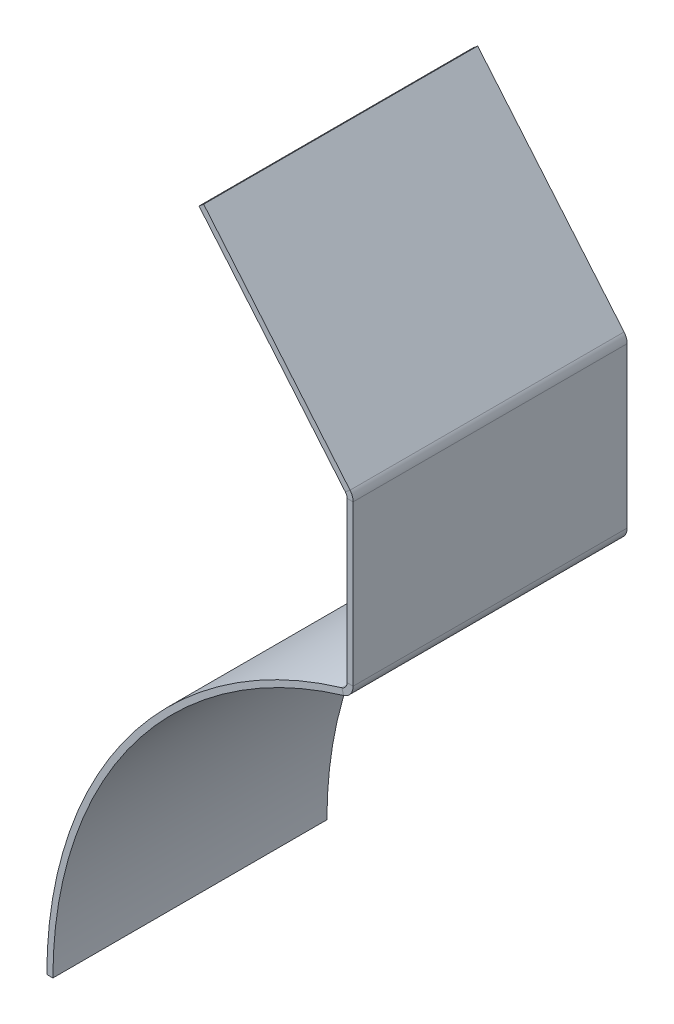
from build123d import *

# Parameters (mm, degrees)
BASE_FLANGE1_DEPTH   = 119.6975
EDGE_FLANGE1_DEPTH   = 119.6975
EDGE_FLANGE2_DEPTH   = 119.6975
EDGE_FLANGE2_2_DEPTH = 119.6975


# Read off the part's stored shape, not the designer's step: Edge-Flange2
# Sheet-metal steps are written as plain solids
with BuildPart() as part:
    # Sketch1 → Base-Flange1 (new body)
    with BuildSketch(Plane.XY):
        with BuildLine():
            ThreePointArc((-50.8, 170.388379885), (-142.557146436, 106.25582337), (-177.8, 0))
            Line((-177.8, 0), (-180.45684, 0))
            ThreePointArc((-180.45684, 0), (-144.68735751, 107.843588959), (-51.559097143, 172.934469105))
            Line((-51.559097143, 172.934469105), (-50.8, 170.388379885))
        make_face()
    extrude(amount=BASE_FLANGE1_DEPTH)

    # Edge-Flange1 section (across the edge) → Edge-Flange1 (add)
    with BuildSketch(Plane(origin=(-49.291175996, 173.610632552, 119.6975), x_dir=(-0.9999999996342678, -2.7045604981568168e-05, 0), z_dir=(0, 0, -1))):
        with BuildLine():
            Line((-2.65684, 2.366572064), (-2.65684, 74.219652496))
            Line((-2.65684, 74.219652496), (0, 74.219652496))
            Line((0, 74.219652496), (0, 2.366572064))
            ThreePointArc((0, 2.366572064), (0.62936233, 0.469112223), (2.267939433, -0.676102109))
            Line((2.267939433, -0.676102109), (1.508911151, -3.222211858))
            ThreePointArc((1.508911151, -3.222211858), (-1.500827273, -1.118682173), (-2.65684, 2.366572064))
        make_face()
    extrude(amount=EDGE_FLANGE1_DEPTH)

    # Edge-Flange2 outline → Edge-Flange2 (cut)
    with BuildSketch(Plane.XY):
        with BuildLine():
            Line((-46.636343312, 247.830356877), (-47.036345835, 247.830346059))
            ThreePointArc((-47.036345835, 247.830346059), (-46.737188142, 246.787726569), (-46.636285905, 245.707740707))
            Line((-46.636285905, 245.707740707), (-46.636343312, 247.830356877))
        make_face()
    extrude(amount=EDGE_FLANGE2_DEPTH, mode=Mode.SUBTRACT)

    # Edge-Flange2 2 outline → Edge-Flange2 2 (add)
    with BuildSketch(Plane.XY):
        with BuildLine():
            ThreePointArc((-47.036345835, 247.830346059), (-47.452236843, 248.682682095), (-48.000778663, 249.456338298))
            Line((-48.000778663, 249.456338298), (-111.945669395, 325.658705996))
            Line((-111.945669395, 325.658705996), (-113.980880724, 323.950867119))
            Line((-113.980880724, 323.950867119), (-50.035989993, 247.748499421))
            ThreePointArc((-50.035989993, 247.748499421), (-49.484631202, 246.793577627), (-49.293125904, 245.707668851))
            Line((-49.293125904, 245.707668851), (-49.293183311, 247.830285021))
            Line((-49.293183311, 247.830285021), (-47.036345835, 247.830346059))
        make_face()
    extrude(amount=EDGE_FLANGE2_2_DEPTH)


solid = part.part
